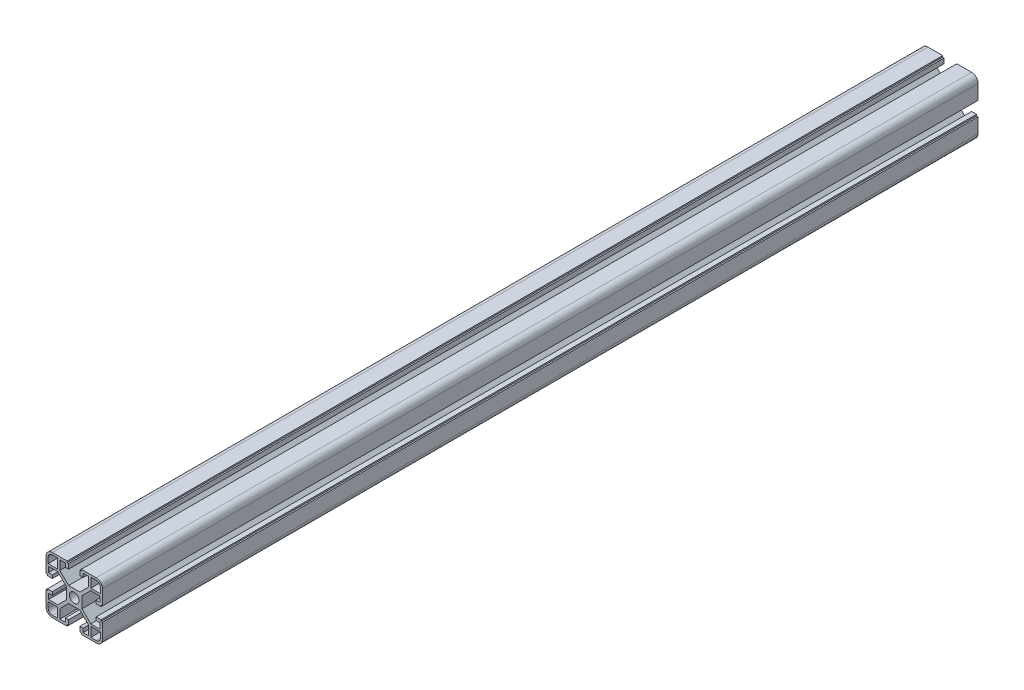
from build123d import *
from build123d.topology import SkipClean

# Parameters (mm, degrees)
BOSS_EXTRUDE1_DEPTH  = 620
MIRROR3_COPY_1_DEPTH = 620
MIRROR3_COPY_2_DEPTH = 620


with BuildPart() as part:
    # Sketch1 → Boss-Extrude1 (new body)
    with BuildSketch(Plane.XY):
        with BuildLine():
            Line((3.4, 0), (5.5, 0))
            Line((5.5, 0), (5.5, 4))
            Line((5.5, 4), (11.69, 10.19))
            Line((11.69, 10.19), (18.2, 10.19))
            Line((18.2, 10.19), (18.2, 6.3))
            Line((18.2, 6.3), (15.5, 6.3))
            Line((15.5, 6.3), (15.5, 4))
            Line((15.5, 4), (19, 4))
            Line((19, 4), (19, 5))
            Line((19, 5), (20, 5))
            Line((20, 5), (20, 15.5))
            ThreePointArc((20, 15.5), (18.681980515, 18.681980515), (15.5, 20))
            Line((15.5, 20), (5, 20))
            Line((5, 20), (5, 19))
            Line((5, 19), (4, 19))
            Line((4, 19), (4, 15.5))
            Line((4, 15.5), (6.3, 15.5))
            Line((6.3, 15.5), (6.3, 18.2))
            Line((6.3, 18.2), (10.19, 18.2))
            Line((10.19, 18.2), (10.19, 11.69))
            Line((10.19, 11.69), (4, 5.5))
            Line((4, 5.5), (0, 5.5))
            Line((0, 5.5), (0, 3.4))
            ThreePointArc((0, 3.4), (2.404163056, 2.404163056), (3.4, 0))
        make_face()
        with BuildLine():
            Line((18.5, 11.69), (18.5, 15.5))
            ThreePointArc((18.5, 15.5), (17.621320344, 17.621320344), (15.5, 18.5))
            Line((15.5, 18.5), (11.69, 18.5))
            Line((11.69, 18.5), (11.69, 11.69))
            Line((11.69, 11.69), (18.5, 11.69))
        make_face(mode=Mode.SUBTRACT)
    boss_extrude1 = extrude(amount=BOSS_EXTRUDE1_DEPTH)

    # Mirror1: Boss-Extrude1 across plane
    add(boss_extrude1.mirror(Plane.ZX))

    # Mirror2: Boss-Extrude1 across plane
    add(boss_extrude1.mirror(Plane(origin=(0, 0, 0), x_dir=(0, 0, 1), z_dir=(1, 0, 0))))

    # Mirror3 copy 1 sketch → Mirror3 copy 1 (add)
    with BuildSketch(Plane(origin=(0, 0, 0), x_dir=(-1, 0, 0), z_dir=(0, 0, 1))):
        with BuildLine():
            Line((3.4, 0), (5.5, 0))
            Line((5.5, 0), (5.5, 4))
            Line((5.5, 4), (11.69, 10.19))
            Line((11.69, 10.19), (18.2, 10.19))
            Line((18.2, 10.19), (18.2, 6.3))
            Line((18.2, 6.3), (15.5, 6.3))
            Line((15.5, 6.3), (15.5, 4))
            Line((15.5, 4), (19, 4))
            Line((19, 4), (19, 5))
            Line((19, 5), (20, 5))
            Line((20, 5), (20, 15.5))
            ThreePointArc((20, 15.5), (18.681980515, 18.681980515), (15.5, 20))
            Line((15.5, 20), (5, 20))
            Line((5, 20), (5, 19))
            Line((5, 19), (4, 19))
            Line((4, 19), (4, 15.5))
            Line((4, 15.5), (6.3, 15.5))
            Line((6.3, 15.5), (6.3, 18.2))
            Line((6.3, 18.2), (10.19, 18.2))
            Line((10.19, 18.2), (10.19, 11.69))
            Line((10.19, 11.69), (4, 5.5))
            Line((4, 5.5), (0, 5.5))
            Line((0, 5.5), (0, 3.4))
            ThreePointArc((0, 3.4), (2.404163056, 2.404163056), (3.4, 0))
        make_face()
        with BuildLine():
            Line((18.5, 11.69), (18.5, 15.5))
            ThreePointArc((18.5, 15.5), (17.621320344, 17.621320344), (15.5, 18.5))
            Line((15.5, 18.5), (11.69, 18.5))
            Line((11.69, 18.5), (11.69, 11.69))
            Line((11.69, 11.69), (18.5, 11.69))
        make_face(mode=Mode.SUBTRACT)
    extrude(amount=MIRROR3_COPY_1_DEPTH)

    # Mirror3 copy 2 sketch → Mirror3 copy 2 (add)
    with SkipClean():  # the faces are left unmerged after this step: merging them gives an invalid solid
        with BuildSketch(Plane.XY):
            with BuildLine():
                Line((3.4, 0), (5.5, 0))
                Line((5.5, 0), (5.5, -4))
                Line((5.5, -4), (11.69, -10.19))
                Line((11.69, -10.19), (18.2, -10.19))
                Line((18.2, -10.19), (18.2, -6.3))
                Line((18.2, -6.3), (15.5, -6.3))
                Line((15.5, -6.3), (15.5, -4))
                Line((15.5, -4), (19, -4))
                Line((19, -4), (19, -5))
                Line((19, -5), (20, -5))
                Line((20, -5), (20, -15.5))
                ThreePointArc((20, -15.5), (18.681980515, -18.681980515), (15.5, -20))
                Line((15.5, -20), (5, -20))
                Line((5, -20), (5, -19))
                Line((5, -19), (4, -19))
                Line((4, -19), (4, -15.5))
                Line((4, -15.5), (6.3, -15.5))
                Line((6.3, -15.5), (6.3, -18.2))
                Line((6.3, -18.2), (10.19, -18.2))
                Line((10.19, -18.2), (10.19, -11.69))
                Line((10.19, -11.69), (4, -5.5))
                Line((4, -5.5), (0, -5.5))
                Line((0, -5.5), (0, -3.4))
                ThreePointArc((0, -3.4), (2.404163056, -2.404163056), (3.4, 0))
            make_face()
            with BuildLine():
                Line((18.5, -11.69), (18.5, -15.5))
                ThreePointArc((18.5, -15.5), (17.621320344, -17.621320344), (15.5, -18.5))
                Line((15.5, -18.5), (11.69, -18.5))
                Line((11.69, -18.5), (11.69, -11.69))
                Line((11.69, -11.69), (18.5, -11.69))
            make_face(mode=Mode.SUBTRACT)
        extrude(amount=MIRROR3_COPY_2_DEPTH)


solid = part.part
